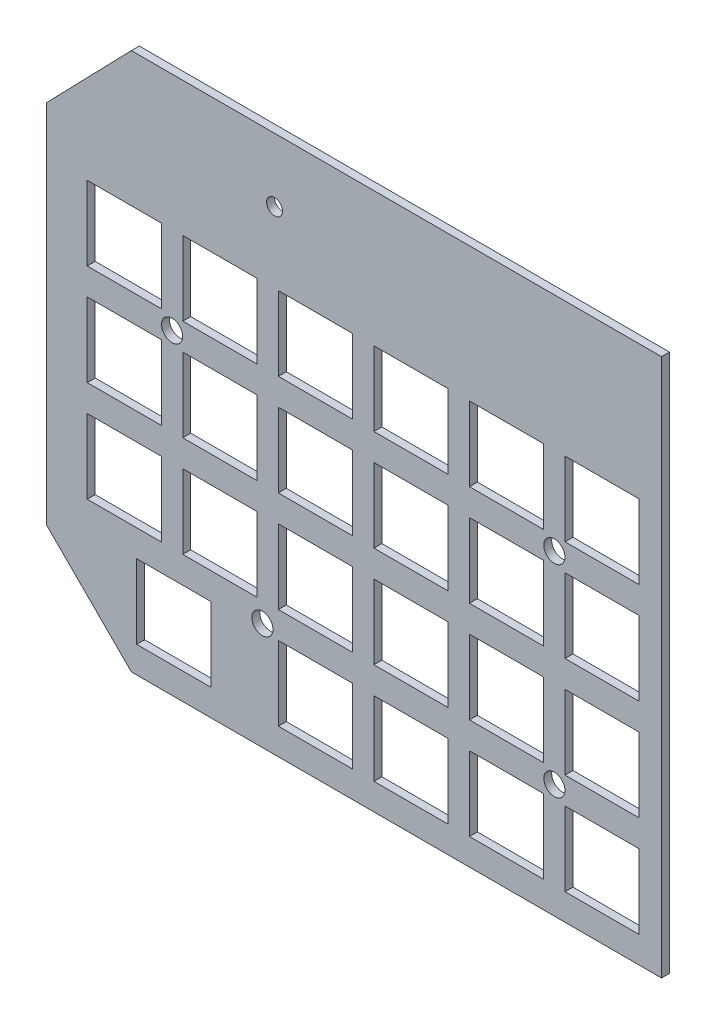
from build123d import *

# Parameters (mm, degrees)
BOSS_EXTRU_1_DEPTH      = 1.5
ESQUISSE3_R             = 2
ESQUISSE3_R_2           = 1.5
ESQUISSE3_W             = 14
ESQUISSE3_H             = 14
ENL_V_MAT_EXTRU_2_DEPTH = 10


with BuildPart() as part:
    # Esquisse1 → Boss.-Extru.1 (new body)
    with BuildSketch(Plane.XY):
        Polygon((0, -85), (16, -101), (116, -101), (116, 0.5), (16, 0.5), (0, -16), align=None)
    extrude(amount=BOSS_EXTRU_1_DEPTH)

    # Esquisse3 → Enlèv. mat.-Extru.2 (cut)
    with BuildSketch(Plane(origin=(0, 0, 0), x_dir=(-1, 0, 0), z_dir=(0, 0, -1))):
        with Locations((-95.78715698, -41.375)):
            Circle(ESQUISSE3_R)
        with Locations((-23.684412821, -41.375)):
            Circle(ESQUISSE3_R)
        with Locations((-40.7163601, -80.721590195)):
            Circle(ESQUISSE3_R)
        with Locations((-95.78715698, -79.475)):
            Circle(ESQUISSE3_R)
        with Locations((-43, -11.5)):
            Circle(ESQUISSE3_R_2)
        with Locations((-86.77431396, -31.85)):
            Rectangle(ESQUISSE3_W, ESQUISSE3_H)
        with Locations((-104.8, -31.85)):
            Rectangle(ESQUISSE3_W, ESQUISSE3_H)
        with Locations((-68.748627921, -31.85)):
            Rectangle(ESQUISSE3_W, ESQUISSE3_H)
        with Locations((-50.722941881, -31.85)):
            Rectangle(ESQUISSE3_W, ESQUISSE3_H)
        with Locations((-32.697255841, -31.85)):
            Rectangle(ESQUISSE3_W, ESQUISSE3_H)
        with Locations((-14.671569801, -31.85)):
            Rectangle(ESQUISSE3_W, ESQUISSE3_H)
        with Locations((-86.77431396, -50.9)):
            Rectangle(ESQUISSE3_W, ESQUISSE3_H)
        with Locations((-68.748627921, -50.9)):
            Rectangle(ESQUISSE3_W, ESQUISSE3_H)
        with Locations((-50.722941881, -50.9)):
            Rectangle(ESQUISSE3_W, ESQUISSE3_H)
        with Locations((-32.697255841, -50.9)):
            Rectangle(ESQUISSE3_W, ESQUISSE3_H)
        with Locations((-14.671569801, -50.9)):
            Rectangle(ESQUISSE3_W, ESQUISSE3_H)
        with Locations((-86.77431396, -69.95)):
            Rectangle(ESQUISSE3_W, ESQUISSE3_H)
        with Locations((-68.748627921, -69.95)):
            Rectangle(ESQUISSE3_W, ESQUISSE3_H)
        with Locations((-50.722941881, -69.95)):
            Rectangle(ESQUISSE3_W, ESQUISSE3_H)
        with Locations((-32.697255841, -69.95)):
            Rectangle(ESQUISSE3_W, ESQUISSE3_H)
        with Locations((-14.671569801, -69.95)):
            Rectangle(ESQUISSE3_W, ESQUISSE3_H)
        with Locations((-86.77431396, -89)):
            Rectangle(ESQUISSE3_W, ESQUISSE3_H)
        with Locations((-68.748627921, -89)):
            Rectangle(ESQUISSE3_W, ESQUISSE3_H)
        with Locations((-50.722941881, -89)):
            Rectangle(ESQUISSE3_W, ESQUISSE3_H)
        with Locations((-104.8, -50.9)):
            Rectangle(ESQUISSE3_W, ESQUISSE3_H)
        with Locations((-104.8, -69.95)):
            Rectangle(ESQUISSE3_W, ESQUISSE3_H)
        with Locations((-104.8, -89)):
            Rectangle(ESQUISSE3_W, ESQUISSE3_H)
        with Locations((-24, -89)):
            Rectangle(ESQUISSE3_W, ESQUISSE3_H)
    extrude(amount=-ENL_V_MAT_EXTRU_2_DEPTH, mode=Mode.SUBTRACT)


solid = part.part
